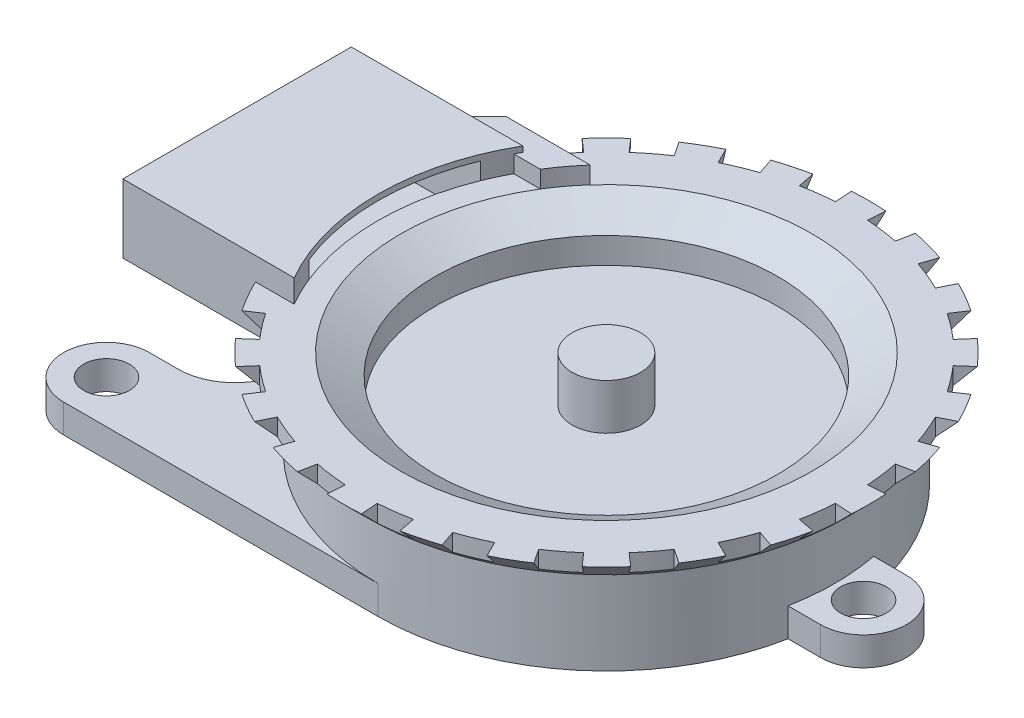
from build123d import *

# Parameters (mm, degrees)
SKETCH1_R                = 40
BOSS_EXTRUDE1_DEPTH      = 20
SKETCH2_R                = 4
BOSS_EXTRUDE2_DEPTH      = 5
SKETCH3_R                = 30
SKETCH3_R_2              = 6
CUT_EXTRUDE2_DEPTH       = 8
CHAMFER1_SIZE            = 6
CHAMFER1_SIZE2           = 3.464101615
BOSS_EXTRUDE3_DEPTH      = 4
BOSS_EXTRUDE3_DEPTH_BACK = 8
CUT_EXTRUDE3_REACH       = 128.087
CUT_EXTRUDE3_END_RADIUS  = 40
SKETCH7_W                = 30
SKETCH7_H                = 9
RIB1_REACH               = 81.715
SKETCH9_WALL_W           = 178.400308644
SKETCH9_WALL_H           = 5
BOSS_EXTRUDE10_DEPTH     = 3
BOSS_EXTRUDE12_START     = -4
BOSS_EXTRUDE12_DEPTH     = 4
CHAMFER2_SIZE            = 4
CUT_EXTRUDE4_REACH       = 83.82
CIRPATTERN1_START        = 17
CIRPATTERN1_DEPTH        = 3


# Read off the part's stored shape, not the designer's step: CirPattern1
with BuildPart() as part:
    # Sketch1 → Boss-Extrude1 (new body)
    with BuildSketch(Plane(origin=(0, 0, 0), x_dir=(1, 0, 0), z_dir=(0, 1, 0))):
        with Locations(Location((0, 0, 0), (0, 0, 270))):
            Circle(SKETCH1_R)
    extrude(amount=BOSS_EXTRUDE1_DEPTH)

    # Sketch2 → Boss-Extrude2 (add)
    # profile 1 of 2: a face of its own
    with BuildSketch(Plane.XZ):
        with BuildLine():
            Line((-55, 40), (0, 40))
            Line((0, 40), (0, -40))
            Line((0, -40), (-55, -40))
            ThreePointArc((-55, -40), (-62.5, -32.5), (-55, -25))
            Line((-55, -25), (-50, -25))
            ThreePointArc((-50, -25), (-42.928932188, -22.071067812), (-40, -15))
            Line((-40, -15), (-40, 15))
            ThreePointArc((-40, 15), (-42.928932188, 22.071067812), (-50, 25))
            Line((-50, 25), (-55, 25))
            ThreePointArc((-55, 25), (-62.5, 32.5), (-55, 40))
        make_face()
        with Locations(Location((-55, 32.5, 0), (0, 0, 270))):
            Circle(SKETCH2_R, mode=Mode.SUBTRACT)
        with Locations(Location((-55, -32.5, 0), (0, 0, 270))):
            Circle(SKETCH2_R, mode=Mode.SUBTRACT)
    # profile 2 of 2: a face of its own
    with BuildSketch(Plane.XZ):
        with BuildLine():
            Line((22.970276422, 7.5), (45, 7.5))
            ThreePointArc((45, 7.5), (52.5, 0), (45, -7.5))
            Line((45, -7.5), (22.970276422, -7.5))
            Line((22.970276422, -7.5), (22.970276422, 7.5))
        make_face()
        with Locations(Location((45, 0, 0), (0, 0, 270))):
            Circle(SKETCH2_R, mode=Mode.SUBTRACT)
    extrude(amount=-BOSS_EXTRUDE2_DEPTH)

    # Sketch3 → Cut-Extrude2 (cut)
    with BuildSketch(Plane(origin=(0, 20, 0), x_dir=(1, 0, 0), z_dir=(0, 1, 0))):
        with Locations(Location((0, 0, 0), (0, 0, 270))):
            Circle(SKETCH3_R)
        with Locations(Location((0, 0, 0), (0, 0, 270))):
            Circle(SKETCH3_R_2, mode=Mode.SUBTRACT)
    extrude(amount=-CUT_EXTRUDE2_DEPTH, mode=Mode.SUBTRACT)

    # Chamfer1
    chamfer1_edges = [part.edges().sort_by_distance(p)[0] for p in [
        (0, 20, -30),
    ]]
    chamfer1_side = [part.faces().sort_by_distance(p)[0] for p in [
        (0, 20, -38.86862915),
    ]]
    chamfer(chamfer1_edges, length=CHAMFER1_SIZE, length2=CHAMFER1_SIZE2, reference=chamfer1_side[0])

    # Sketch6 → Boss-Extrude3 (add, two sides: drawn at the far end of the back side and taken through both)
    with BuildSketch(Plane(origin=(0, 20, 0), x_dir=(1, 0, 0), z_dir=(0, 1, 0)).offset(-BOSS_EXTRUDE3_DEPTH_BACK)):
        with BuildLine():
            Line((-34.641016151, 20), (-64.641016151, 20))
            Line((-64.641016151, 20), (-64.641016151, -20))
            Line((-64.641016151, -20), (-34.641016151, -20))
            ThreePointArc((-34.641016151, -20), (-40, 0), (-34.641016151, 20))
        make_face()
    extrude(amount=BOSS_EXTRUDE3_DEPTH + BOSS_EXTRUDE3_DEPTH_BACK)

    # Cut-Extrude3: up to this cylinder (the profile starts outside it)
    cut_extrude3_end = Plane(origin=(0, 18.5, 0), z_dir=(0, -1, 0)) * Cylinder(CUT_EXTRUDE3_END_RADIUS, 337.174, mode=Mode.PRIVATE)
    # Sketch7 → Cut-Extrude3 (cut, up to the surface)
    with BuildSketch(Plane.ZY.offset(64.641016151), mode=Mode.PRIVATE) as cut_extrude3_sk1:
        with Locations((0, 18.5)):
            Rectangle(SKETCH7_W, SKETCH7_H)
    cut_extrude3_tool1 = extrude(cut_extrude3_sk1.sketch, amount=-CUT_EXTRUDE3_REACH, mode=Mode.PRIVATE) - cut_extrude3_end
    add(cut_extrude3_tool1.solids().sort_by_distance((-64.641016, 18.5, 0))[0], mode=Mode.SUBTRACT)

    # Sketch9 wall → Rib1 (add, up to next)
    with BuildSketch(Plane(origin=(-46, 6, 0), x_dir=(-0.707106781187, 0.707106781187, 0), z_dir=(-0.707106781187, -0.707106781187, 0)), mode=Mode.PRIVATE) as rib1_sk1:
        Rectangle(SKETCH9_WALL_W, SKETCH9_WALL_H)
    rib1_tool1 = extrude(rib1_sk1.sketch, amount=-RIB1_REACH, mode=Mode.PRIVATE) - part.part
    add(rib1_tool1.solids().sort_by_distance((-46, 6, 0))[0])

    # Sketch13 → Boss-Extrude10 (add)
    with BuildSketch(Plane(origin=(0, 20, 0), x_dir=(1, 0, 0), z_dir=(0, 1, 0))):
        with BuildLine():
            Line((-30.577769703, 19), (-44.577769703, 19))
            Line((-44.577769703, 19), (-44.577769703, 21))
            Line((-44.577769703, 21), (-41.577769703, 24))
            Line((-41.577769703, 24), (-26.83281573, 24))
            ThreePointArc((-26.83281573, 24), (-28.813952001, 21.581384804), (-30.577769703, 19))
        make_face()
    extrude(amount=BOSS_EXTRUDE10_DEPTH)

    # Sketch14 → Boss-Extrude12 (add)
    with BuildSketch(Plane(origin=(0, 20, 0), x_dir=(1, 0, 0), z_dir=(0, 1, 0)).offset(BOSS_EXTRUDE12_START)):
        with BuildLine():
            Line((-34.641016151, 20), (-41.424630354, 20))
            ThreePointArc((-41.424630354, 20), (46, 0), (-41.424630354, -20))
            Line((-41.424630354, -20), (-34.641016151, -20))
            ThreePointArc((-34.641016151, -20), (40, 0), (-34.641016151, 20))
        make_face()
    extrude(amount=BOSS_EXTRUDE12_DEPTH)

    # Chamfer2
    chamfer2_edges = [part.edges().sort_by_distance(p)[0] for p in [
        (46, 16, 0),
    ]]
    chamfer(chamfer2_edges, length=CHAMFER2_SIZE - 0.0001)  # a hair under: the kernel refuses the full size

    # Sketch15 → Cut-Extrude4 (cut, up to next)
    with BuildSketch(Plane(origin=(0, 20, 0), x_dir=(1, 0, 0), z_dir=(0, 1, 0)), mode=Mode.PRIVATE) as cut_extrude4_sk1:
        with BuildLine():
            Line((-8.388883847, -42.173767057), (-8.974154813, -45.116122899))
            ThreePointArc((-8.974154813, -45.116122899), (-6.004204842, -45.606463623), (-3.008543945, -45.901510469))
            Line((-3.008543945, -45.901510469), (-2.812334557, -42.907933699))
            ThreePointArc((-2.812334557, -42.907933699), (-5.612626265, -42.632129039), (-8.388883847, -42.173767057))
        make_face()
    cut_extrude4_tool1 = extrude(cut_extrude4_sk1.sketch, amount=-CUT_EXTRUDE4_REACH, mode=Mode.PRIVATE) & part.part
    add(cut_extrude4_tool1.solids().sort_by_distance((-5.806468, 20, 44.104502))[0], mode=Mode.SUBTRACT)

    # CirPattern1 outline → CirPattern1 (cut)
    with BuildSketch(Plane(origin=(0, 0, 0), x_dir=(1, 0, 0), z_dir=(0, 1, 0)).offset(CIRPATTERN1_START)):
        with BuildLine():
            ThreePointArc((8.388883847, -42.173767057), (5.612626266, -42.632129039), (2.812334557, -42.907933699))
            Line((2.812334557, -42.907933699), (3.008543945, -45.901510469))
            Line((3.008543945, -45.901510469), (3.080542753, -47))
            Line((3.080542753, -47), (9.348881267, -47))
            Line((9.348881267, -47), (8.974154813, -45.116122899))
            Line((8.974154813, -45.116122899), (8.388883847, -42.173767057))
        make_face()
        with BuildLine():
            Line((-23.177835023, -47), (-15.954350166, -47))
            Line((-15.954350166, -47), (-14.786215404, -43.558785957))
            Line((-14.786215404, -43.558785957), (-13.821897008, -40.717995568))
            ThreePointArc((-13.821897008, -40.717995568), (-16.455387592, -39.726819898), (-19.018413679, -38.565527886))
            Line((-19.018413679, -38.565527886), (-20.34527975, -41.256146111))
            Line((-20.34527975, -41.256146111), (-23.177835023, -47))
        make_face()
        with BuildLine():
            Line((14.786215404, -43.558785957), (15.954350166, -47))
            Line((15.954350166, -47), (23.177835023, -47))
            Line((23.177835023, -47), (20.34527975, -41.256146111))
            Line((20.34527975, -41.256146111), (19.018413679, -38.565527886))
            ThreePointArc((19.018413679, -38.565527886), (16.455387592, -39.726819898), (13.821897008, -40.717995568))
            Line((13.821897008, -40.717995568), (14.786215404, -43.558785957))
        make_face()
        with BuildLine():
            Line((-40, -47), (-31.404395982, -47))
            Line((-31.404395982, -47), (-25.556230719, -38.247602166))
            Line((-25.556230719, -38.247602166), (-23.88952002, -35.753193329))
            ThreePointArc((-23.88952002, -35.753193329), (-26.176741447, -34.114193633), (-28.351870049, -32.329111722))
            Line((-28.351870049, -32.329111722), (-30.329907495, -34.584631144))
            Line((-30.329907495, -34.584631144), (-40, -45.61125832))
            Line((-40, -45.61125832), (-40, -47))
        make_face()
        with BuildLine():
            Line((25.556230719, -38.247602166), (31.404395982, -47))
            Line((31.404395982, -47), (41.217893767, -47))
            Line((41.217893767, -47), (30.329907495, -34.584631144))
            Line((30.329907495, -34.584631144), (28.351870049, -32.329111722))
            ThreePointArc((28.351870049, -32.329111722), (26.176741447, -34.114193633), (23.88952002, -35.753193329))
            Line((23.88952002, -35.753193329), (25.556230719, -38.247602166))
        make_face()
        with BuildLine():
            Line((-40, -26.727145517), (-40, -35.079058523))
            Line((-40, -35.079058523), (-34.584631144, -30.329907495))
            Line((-34.584631144, -30.329907495), (-32.329111722, -28.351870049))
            ThreePointArc((-32.329111722, -28.351870049), (-34.114193633, -26.176741447), (-35.753193329, -23.88952002))
            Line((-35.753193329, -23.88952002), (-38.247602166, -25.556230719))
            Line((-38.247602166, -25.556230719), (-40, -26.727145517))
        make_face()
        with BuildLine():
            Line((34.584631144, -30.329907495), (47, -41.217893767))
            Line((47, -41.217893767), (47, -31.404395982))
            Line((47, -31.404395982), (38.247602166, -25.556230719))
            Line((38.247602166, -25.556230719), (35.753193329, -23.88952002))
            ThreePointArc((35.753193329, -23.88952002), (34.114193633, -26.176741447), (32.329111722, -28.351870049))
            Line((32.329111722, -28.351870049), (34.584631144, -30.329907495))
        make_face()
        with BuildLine():
            Line((-40, 35.079058523), (-40, 26.727145517))
            Line((-40, 26.727145517), (-38.247602166, 25.556230719))
            Line((-38.247602166, 25.556230719), (-35.753193329, 23.88952002))
            ThreePointArc((-35.753193329, 23.88952002), (-34.114193633, 26.176741447), (-32.329111722, 28.351870049))
            Line((-32.329111722, 28.351870049), (-34.584631144, 30.329907495))
            Line((-34.584631144, 30.329907495), (-40, 35.079058523))
        make_face()
        with BuildLine():
            Line((41.256146111, -20.34527975), (47, -23.177835023))
            Line((47, -23.177835023), (47, -15.954350166))
            Line((47, -15.954350166), (43.558785957, -14.786215404))
            Line((43.558785957, -14.786215404), (40.717995568, -13.821897008))
            ThreePointArc((40.717995568, -13.821897008), (39.726819898, -16.455387592), (38.565527886, -19.018413679))
            Line((38.565527886, -19.018413679), (41.256146111, -20.34527975))
        make_face()
        with BuildLine():
            Line((-40, 47), (-40, 45.61125832))
            Line((-40, 45.61125832), (-30.329907495, 34.584631144))
            Line((-30.329907495, 34.584631144), (-28.351870049, 32.329111722))
            ThreePointArc((-28.351870049, 32.329111722), (-26.176741447, 34.114193633), (-23.88952002, 35.753193329))
            Line((-23.88952002, 35.753193329), (-25.556230719, 38.247602166))
            Line((-25.556230719, 38.247602166), (-31.404395982, 47))
            Line((-31.404395982, 47), (-40, 47))
        make_face()
        with BuildLine():
            Line((45.116122899, -8.974154813), (47, -9.348881267))
            Line((47, -9.348881267), (47, -3.080542753))
            Line((47, -3.080542753), (45.901510469, -3.008543945))
            Line((45.901510469, -3.008543945), (42.907933699, -2.812334557))
            ThreePointArc((42.907933699, -2.812334557), (42.632129039, -5.612626266), (42.173767057, -8.388883847))
            Line((42.173767057, -8.388883847), (45.116122899, -8.974154813))
        make_face()
        with BuildLine():
            Line((45.901510469, 3.008543945), (47, 3.080542753))
            Line((47, 3.080542753), (47, 9.348881267))
            Line((47, 9.348881267), (45.116122899, 8.974154813))
            Line((45.116122899, 8.974154813), (42.173767057, 8.388883847))
            ThreePointArc((42.173767057, 8.388883847), (42.632129039, 5.612626266), (42.907933699, 2.812334557))
            Line((42.907933699, 2.812334557), (45.901510469, 3.008543945))
        make_face()
        with BuildLine():
            Line((-15.954350166, 47), (-23.177835023, 47))
            Line((-23.177835023, 47), (-20.34527975, 41.256146111))
            Line((-20.34527975, 41.256146111), (-19.018413679, 38.565527886))
            ThreePointArc((-19.018413679, 38.565527886), (-16.455387592, 39.726819898), (-13.821897008, 40.717995568))
            Line((-13.821897008, 40.717995568), (-14.786215404, 43.558785957))
            Line((-14.786215404, 43.558785957), (-15.954350166, 47))
        make_face()
        with BuildLine():
            Line((43.558785957, 14.786215404), (47, 15.954350166))
            Line((47, 15.954350166), (47, 23.177835023))
            Line((47, 23.177835023), (41.256146111, 20.34527975))
            Line((41.256146111, 20.34527975), (38.565527886, 19.018413679))
            ThreePointArc((38.565527886, 19.018413679), (39.726819898, 16.455387592), (40.717995568, 13.821897008))
            Line((40.717995568, 13.821897008), (43.558785957, 14.786215404))
        make_face()
        with BuildLine():
            Line((-3.080542753, 47), (-9.348881267, 47))
            Line((-9.348881267, 47), (-8.974154813, 45.116122899))
            Line((-8.974154813, 45.116122899), (-8.388883847, 42.173767057))
            ThreePointArc((-8.388883847, 42.173767057), (-5.612626266, 42.632129039), (-2.812334557, 42.907933699))
            Line((-2.812334557, 42.907933699), (-3.008543945, 45.901510469))
            Line((-3.008543945, 45.901510469), (-3.080542753, 47))
        make_face()
        with BuildLine():
            Line((38.247602166, 25.556230719), (47, 31.404395982))
            Line((47, 31.404395982), (47, 41.217893767))
            Line((47, 41.217893767), (34.584631144, 30.329907495))
            Line((34.584631144, 30.329907495), (32.329111722, 28.351870049))
            ThreePointArc((32.329111722, 28.351870049), (34.114193633, 26.176741447), (35.753193329, 23.88952002))
            Line((35.753193329, 23.88952002), (38.247602166, 25.556230719))
        make_face()
        with BuildLine():
            Line((9.348881267, 47), (3.080542753, 47))
            Line((3.080542753, 47), (3.008543945, 45.901510469))
            Line((3.008543945, 45.901510469), (2.812334557, 42.907933699))
            ThreePointArc((2.812334557, 42.907933699), (5.612626266, 42.632129039), (8.388883847, 42.173767057))
            Line((8.388883847, 42.173767057), (8.974154813, 45.116122899))
            Line((8.974154813, 45.116122899), (9.348881267, 47))
        make_face()
        with BuildLine():
            Line((23.177835023, 47), (15.954350166, 47))
            Line((15.954350166, 47), (14.786215404, 43.558785957))
            Line((14.786215404, 43.558785957), (13.821897008, 40.717995568))
            ThreePointArc((13.821897008, 40.717995568), (16.455387592, 39.726819898), (19.018413679, 38.565527886))
            Line((19.018413679, 38.565527886), (20.34527975, 41.256146111))
            Line((20.34527975, 41.256146111), (23.177835023, 47))
        make_face()
        with BuildLine():
            Line((30.329907495, 34.584631144), (41.217893767, 47))
            Line((41.217893767, 47), (31.404395982, 47))
            Line((31.404395982, 47), (25.556230719, 38.247602166))
            Line((25.556230719, 38.247602166), (23.88952002, 35.753193329))
            ThreePointArc((23.88952002, 35.753193329), (26.176741447, 34.114193633), (28.351870049, 32.329111722))
            Line((28.351870049, 32.329111722), (30.329907495, 34.584631144))
        make_face()
    extrude(amount=CIRPATTERN1_DEPTH, mode=Mode.SUBTRACT)


solid = part.part
